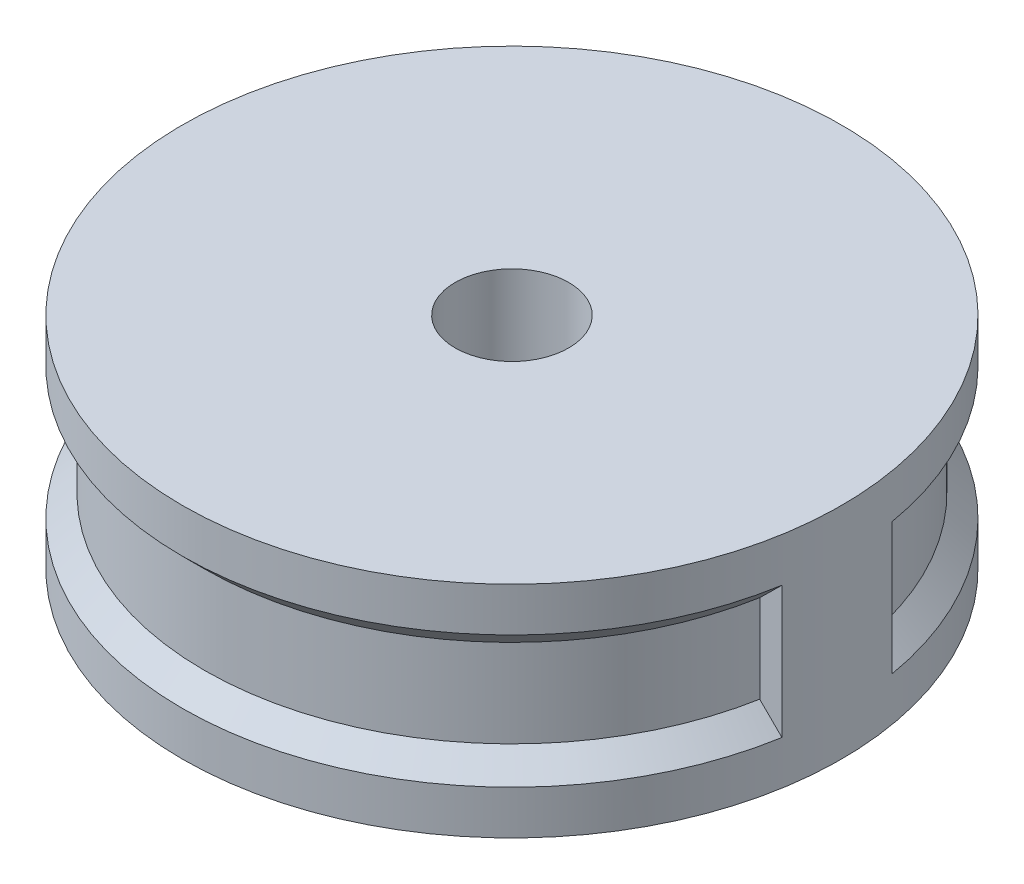
from build123d import *

# Parameters (mm, degrees)
SKETCH1_R           = 14
SKETCH1_R_2         = 2.585
BOSS_EXTRUDE1_DEPTH = 10
SKETCH1_3_R         = 15
SKETCH1_3_R_2       = 14
BOSS_EXTRUDE2_DEPTH = 2
BOSS_EXTRUDE3_START = 8
SKETCH1_4_R         = 15
SKETCH1_4_R_2       = 14
BOSS_EXTRUDE3_DEPTH = 2
CHAMFER1_SIZE       = 1
BOSS_EXTRUDE4_REACH = 25.452


with BuildPart() as part:
    # Sketch1 → Boss-Extrude1 (new body)
    with BuildSketch(Plane(origin=(0, 0, 0), x_dir=(1, 0, 0), z_dir=(0, 1, 0))):
        with Locations(Location((0, 0, 0), (0, 0, 270))):
            Circle(SKETCH1_R)
        with Locations(Location((0, 0, 0), (0, 0, 270))):
            Circle(SKETCH1_R_2, mode=Mode.SUBTRACT)
    extrude(amount=BOSS_EXTRUDE1_DEPTH)

    # Sketch1<3> → Boss-Extrude2 (add)
    with BuildSketch(Plane(origin=(0, 0, 0), x_dir=(1, 0, 0), z_dir=(0, 1, 0))):
        with Locations(Location((0, 0, 0), (0, 0, 270))):
            Circle(SKETCH1_3_R)
        with Locations(Location((0, 0, 0), (0, 0, 270))):
            Circle(SKETCH1_3_R_2, mode=Mode.SUBTRACT)
    extrude(amount=BOSS_EXTRUDE2_DEPTH)

    # Sketch1<4> → Boss-Extrude3 (add)
    with BuildSketch(Plane(origin=(0, 0, 0), x_dir=(1, 0, 0), z_dir=(0, 1, 0)).offset(BOSS_EXTRUDE3_START)):
        with Locations(Location((0, 0, 0), (0, 0, 270))):
            Circle(SKETCH1_4_R)
        with Locations(Location((0, 0, 0), (0, 0, 270))):
            Circle(SKETCH1_4_R_2, mode=Mode.SUBTRACT)
    extrude(amount=BOSS_EXTRUDE3_DEPTH)

    # Chamfer1
    chamfer1_edges = [part.edges().sort_by_distance(p)[0] for p in [
        (0, 2, -14),
        (0, 8, -14),
    ]]
    chamfer(chamfer1_edges, length=CHAMFER1_SIZE - 0.0001)  # a hair under: the kernel refuses the full size

    # Sketch2 → Boss-Extrude4 (add, up to next)
    with BuildSketch(Plane(origin=(0, 0, 0), x_dir=(1, 0, 0), z_dir=(0, 1, 0)), mode=Mode.PRIVATE) as boss_extrude4_sk1:
        with BuildLine():
            Line((14.790199458, 2.5), (13.790199458, 2.5))
            Line((13.790199458, 2.5), (13.790199458, -2.5))
            Line((13.790199458, -2.5), (14.790199458, -2.5))
            ThreePointArc((14.790199458, -2.5), (15, 0), (14.790199458, 2.5))
        make_face()
    boss_extrude4_tool1 = extrude(boss_extrude4_sk1.sketch, amount=BOSS_EXTRUDE4_REACH, mode=Mode.PRIVATE) - part.part
    add(boss_extrude4_tool1.solids().sort_by_distance((14.361944, 0, 0))[0])


solid = part.part
